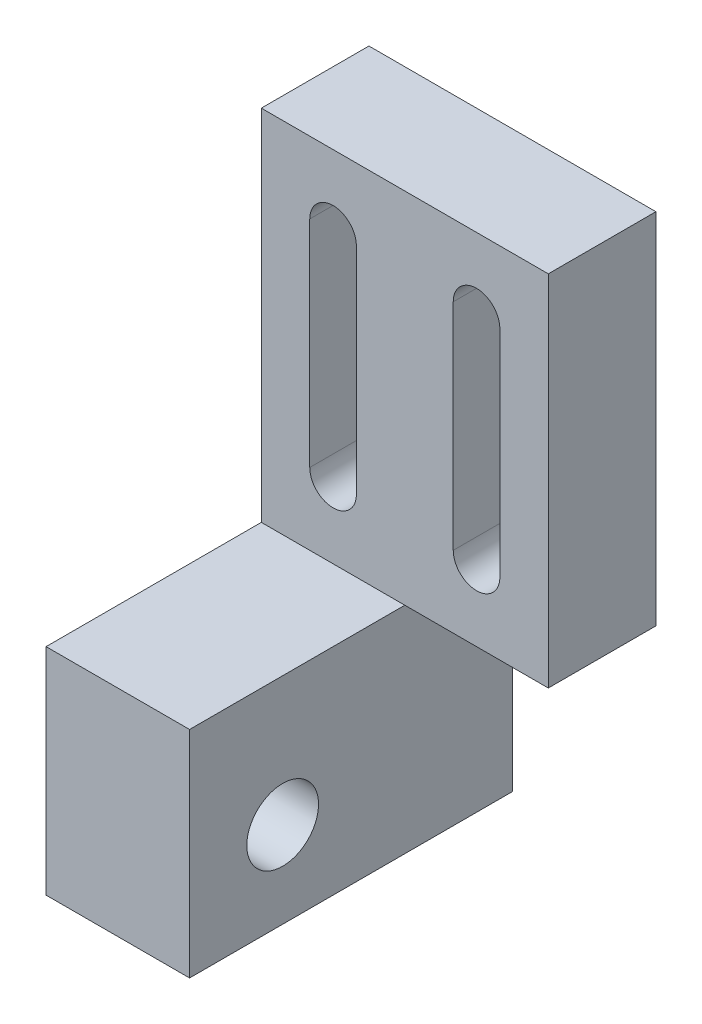
from build123d import *

# Parameters (mm, degrees)
SKETCH_1_W          = 4
SKETCH_1_H          = 6
EXTRUDE_1_DEPTH     = 9
SKETCH_5_W          = 8
SKETCH_5_H          = 10
EXTRUDE_3_DEPTH     = 3
CUT_EXTRUDE_4_DEPTH = 21.241366061
CUT_EXTRUDE_5_DEPTH = 87.358976951


with BuildPart() as part:
    # 草图1 → 凸台-拉伸1 (new body)
    with BuildSketch(Plane.XY):
        with Locations((-82.6, 3.27)):
            Rectangle(SKETCH_1_W, SKETCH_1_H)
    extrude(amount=EXTRUDE_1_DEPTH)

    # 草图5 → 凸台-拉伸3 (add)
    with BuildSketch(Plane.XY):
        with Locations((-80.6, 11.27)):
            Rectangle(SKETCH_5_W, SKETCH_5_H)
    extrude(amount=EXTRUDE_3_DEPTH)

    # 草图7 → 切除-拉伸4 (cut, through all)
    with BuildSketch(Plane.ZY.offset(84.6)):
        with BuildLine():
            ThreePointArc((7.055, 3.429934208), (6.405, 3.67), (5.755, 3.429934208))
            ThreePointArc((5.755, 3.429934208), (5.986669987, 1.761704894), (7.405, 2.67))
            ThreePointArc((7.405, 2.67), (7.313295106, 3.088330013), (7.055, 3.429934208))
        make_face()
    extrude(amount=-CUT_EXTRUDE_4_DEPTH, mode=Mode.SUBTRACT)

    # 草图8 → 切除-拉伸5 (cut, through all)
    with BuildSketch(Plane.XY.offset(3)):
        with BuildLine():
            Line((-83.25, 8.27), (-83.25, 14.27))
            ThreePointArc((-83.25, 14.27), (-82.6, 14.92), (-81.95, 14.27))
            Line((-81.95, 14.27), (-81.95, 8.27))
            ThreePointArc((-81.95, 8.27), (-82.6, 7.62), (-83.25, 8.27))
        make_face()
        with BuildLine():
            Line((-77.95, 14.27), (-77.95, 8.27))
            ThreePointArc((-77.95, 8.27), (-78.6, 7.62), (-79.25, 8.27))
            Line((-79.25, 8.27), (-79.25, 14.27))
            ThreePointArc((-79.25, 14.27), (-78.6, 14.92), (-77.95, 14.27))
        make_face()
    extrude(amount=-CUT_EXTRUDE_5_DEPTH, mode=Mode.SUBTRACT)


solid = part.part
